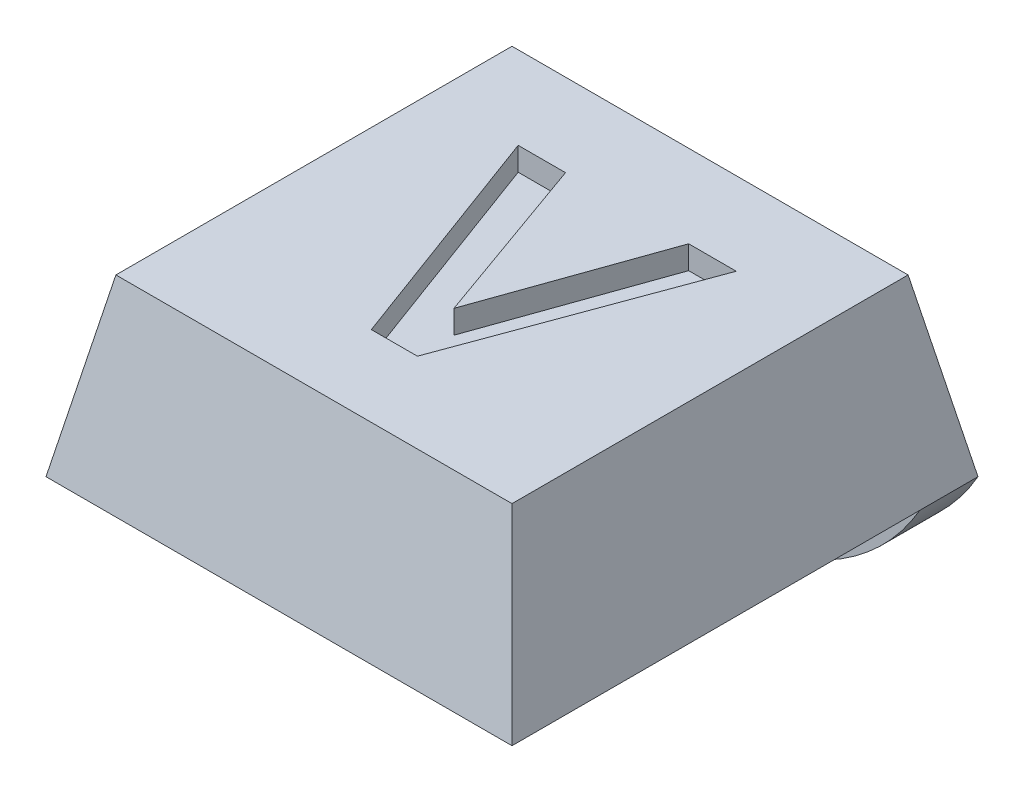
from build123d import *

# Parameters (mm, degrees)
SKETCH1_W               = 8
SKETCH1_H               = 8
BOSS_EXTRUDE1_DEPTH     = 3
CUT_EXTRUDE1_DEPTH      = 12.704699911
CUT_EXTRUDE1_DEPTH_BACK = 12.704699911
CUT_EXTRUDE2_DEPTH      = 11
SKETCH4_R               = 1.75
CUT_EXTRUDE3_DEPTH      = 0.4
SKETCH5_W               = 8
SKETCH5_H               = 1
BOSS_EXTRUDE2_DEPTH     = 2
FILLET1_R               = 4
CUT_EXTRUDE4_DEPTH      = 0.4


with BuildPart() as part:
    # Sketch1 → Boss-Extrude1 (new body)
    with BuildSketch(Plane(origin=(0, 0, 0), x_dir=(1, 0, 0), z_dir=(0, 1, 0))):
        with Locations((4, 4)):
            Rectangle(SKETCH1_W, SKETCH1_H)
    extrude(amount=BOSS_EXTRUDE1_DEPTH)

    # Sketch2 → Cut-Extrude1 (cut, two sides: drawn at the far end of the back side and taken through both)
    with BuildSketch(Plane.XY.offset(-CUT_EXTRUDE1_DEPTH_BACK)):
        Polygon((0, 0), (0.6, 3), (0, 3), align=None)
        Polygon((8, 0), (7.4, 3), (8, 3), align=None)
    extrude(amount=CUT_EXTRUDE1_DEPTH + CUT_EXTRUDE1_DEPTH_BACK, mode=Mode.SUBTRACT)

    # Sketch3 → Cut-Extrude2 (cut)
    with BuildSketch(Plane(origin=(0, 0, 0), x_dir=(0, 0, -1), z_dir=(1, 0, 0))):
        Polygon((0, 0), (0.6, 3), (0, 3), align=None)
        Polygon((8, 3), (7.4, 3), (8, 0), align=None)
    extrude(amount=CUT_EXTRUDE2_DEPTH, mode=Mode.SUBTRACT)

    # Sketch4 → Cut-Extrude3 (cut)
    with BuildSketch(Plane.XZ):
        with Locations(Location((4, -3.75, 0), (0, 0, 270))):
            Circle(SKETCH4_R)
    extrude(amount=-CUT_EXTRUDE3_DEPTH, mode=Mode.SUBTRACT)

    # Sketch5 → Boss-Extrude2 (add)
    with BuildSketch(Plane.XZ):
        with Locations((4, -7.5)):
            Rectangle(SKETCH5_W, SKETCH5_H)
    extrude(amount=BOSS_EXTRUDE2_DEPTH)

    # Fillet1
    # the kernel refuses this fillet: 4 mm, written as the material it takes off along each edge
    with BuildSketch(Plane(origin=(8, -2, -16.660254038), x_dir=(0, 1, 0), z_dir=(0, 0, 1)), Plane(origin=(0, -2, 1.660254038), x_dir=(0, 1, 0), z_dir=(0, 0, -1))) as fillet1_piece_1:
        with BuildLine():
            CenterArc((4, 3.464101615), FILLET1_R, 180, 60)
            Line((0, 3.464101615), (-0.08, 3.464101615))
            Line((-0.08, 3.464101615), (-0.08, 0))
            Line((-0.08, 0), (0, -0.08))
            ThreePointArc((0, -0.08), (1, -0.08), (1.96, -0.069282032))
            Line((1.96, -0.069282032), (2, 0))
        make_face()
    extrude(amount=18.320508076, mode=Mode.SUBTRACT)

    # Sketch6 → Cut-Extrude4 (cut)
    with BuildSketch(Plane(origin=(0, 3, 0), x_dir=(1, 0, 0), z_dir=(0, 1, 0))):
        Polygon((3.605424489, 1.979723732), (2.126257822, 5.979723732), (2.938757822, 5.979723732), (3.998052694, 3.005364758), (5.053341155, 5.979723732), (5.869847566, 5.979723732), (4.396289873, 1.979723732), align=None)
    extrude(amount=-CUT_EXTRUDE4_DEPTH, mode=Mode.SUBTRACT)


solid = part.part
